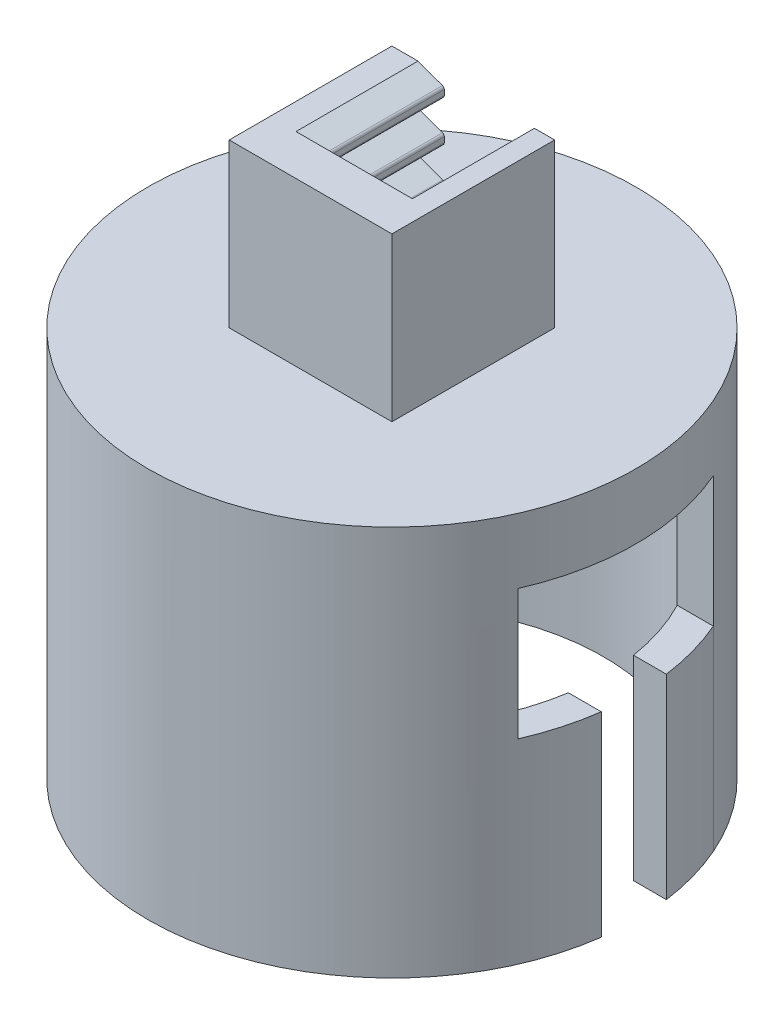
from build123d import *

# Parameters (mm, degrees)
SKETCH1_R           = 15
SKETCH1_R_2         = 13
BOSS_EXTRUDE1_DEPTH = 20
SKETCH2_R           = 15
BOSS_EXTRUDE2_DEPTH = 4
CUT_EXTRUDE1_DEPTH  = 4
SKETCH4_W           = 10
SKETCH4_H           = 10
BOSS_EXTRUDE3_DEPTH = 10
CUT_EXTRUDE2_DEPTH  = 7.5


with BuildPart() as part:
    # Sketch1 → Boss-Extrude1 (new body)
    with BuildSketch(Plane(origin=(0, 0, 0), x_dir=(1, 0, 0), z_dir=(0, 1, 0))):
        Circle(SKETCH1_R)
        Circle(SKETCH1_R_2, mode=Mode.SUBTRACT)
    extrude(amount=BOSS_EXTRUDE1_DEPTH)

    # Sketch2 → Boss-Extrude2 (add)
    with BuildSketch(Plane(origin=(0, 20, 0), x_dir=(1, 0, 0), z_dir=(0, 1, 0))):
        Circle(SKETCH2_R)
    extrude(amount=BOSS_EXTRUDE2_DEPTH)

    # Sketch3 → Cut-Extrude1 (cut)
    with BuildSketch(Plane(origin=(15, 0, 0), x_dir=(0, 0, -1), z_dir=(1, 0, 0))):
        Polygon((-6, 12), (-2, 12), (-2, 0), (2, 0), (2, 12), (6, 12), (6, 20), (-6, 20), align=None)
    extrude(amount=-CUT_EXTRUDE1_DEPTH, mode=Mode.SUBTRACT)

    # Sketch4 → Boss-Extrude3 (add)
    with BuildSketch(Plane(origin=(0, 24, 0), x_dir=(1, 0, 0), z_dir=(0, 1, 0))):
        Rectangle(SKETCH4_W, SKETCH4_H)
    extrude(amount=BOSS_EXTRUDE3_DEPTH)

    # Sketch6 → Cut-Extrude2 (cut)
    with BuildSketch(Plane(origin=(0, 0, -5), x_dir=(-1, 0, 0), z_dir=(0, 0, -1))):
        with BuildLine():
            Line((-1.758355149, 34), (-3.758355149, 34))
            Line((-3.758355149, 34), (-3.758355149, 24))
            Line((-3.758355149, 24), (3.541644851, 24))
            Line((3.541644851, 24), (3.541644851, 24.674283625))
            Line((3.541644851, 24.674283625), (1.891753796, 25.274794859))
            ThreePointArc((1.891753796, 25.274794859), (1.811908661, 25.336062186), (1.781644851, 25.432046729))
            Line((1.781644851, 25.432046729), (1.781644851, 25.755508896))
            ThreePointArc((1.781644851, 25.755508896), (1.811908661, 25.85149344), (1.891753796, 25.912760766))
            Line((1.891753796, 25.912760766), (3.541644851, 26.513272))
            Line((3.541644851, 26.513272), (3.541644851, 27.187555625))
            Line((3.541644851, 27.187555625), (1.891753796, 27.788066859))
            ThreePointArc((1.891753796, 27.788066859), (1.811908661, 27.849334186), (1.781644851, 27.945318729))
            Line((1.781644851, 27.945318729), (1.781644851, 28.268780896))
            ThreePointArc((1.781644851, 28.268780896), (1.811908661, 28.36476544), (1.891753796, 28.426032766))
            Line((1.891753796, 28.426032766), (3.541644851, 29.026544))
            Line((3.541644851, 29.026544), (3.541644851, 29.700827625))
            Line((3.541644851, 29.700827625), (1.891753796, 30.301338859))
            ThreePointArc((1.891753796, 30.301338859), (1.811908661, 30.362606186), (1.781644851, 30.458590729))
            Line((1.781644851, 30.458590729), (1.781644851, 30.782052896))
            ThreePointArc((1.781644851, 30.782052896), (1.811908661, 30.87803744), (1.891753796, 30.939304766))
            Line((1.891753796, 30.939304766), (3.541644851, 31.539816))
            Line((3.541644851, 31.539816), (3.541644851, 32.214099625))
            Line((3.541644851, 32.214099625), (1.891753796, 32.814610859))
            ThreePointArc((1.891753796, 32.814610859), (1.811908661, 32.875878186), (1.781644851, 32.971862729))
            Line((1.781644851, 32.971862729), (1.781644851, 33.295324896))
            ThreePointArc((1.781644851, 33.295324896), (1.811908661, 33.39130944), (1.891753796, 33.452576766))
            Line((1.891753796, 33.452576766), (3.39578677, 34))
            Line((3.39578677, 34), (0.241644851, 34))
            Line((0.241644851, 34), (-1.758355149, 34))
        make_face()
    extrude(amount=-CUT_EXTRUDE2_DEPTH, mode=Mode.SUBTRACT)


solid = part.part
